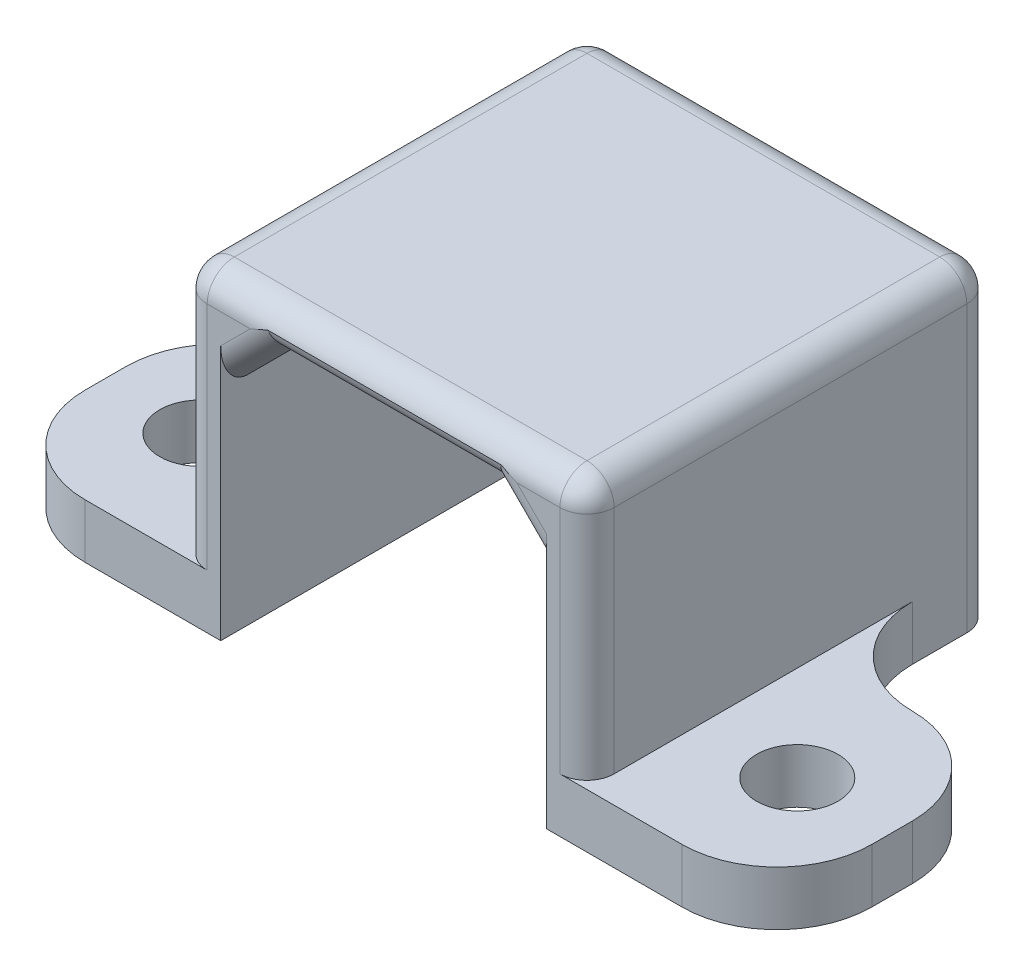
from build123d import *

# Parameters (mm, degrees)
SKETCH2_W           = 15
SKETCH2_H           = 11.5
BOSS_EXTRUDE1_DEPTH = 15
SKETCH3_W           = 12
SKETCH3_H           = 10
CUT_EXTRUDE1_DEPTH  = 15
SKETCH4_W           = 8.5
SKETCH4_H           = 2
BOSS_EXTRUDE2_DEPTH = 7
SKETCH5_R           = 1.5
CUT_EXTRUDE2_DEPTH  = 7
BOSS_EXTRUDE3_DEPTH = 15
SKETCH7_W           = 12
SKETCH7_H           = 0.7
CUT_EXTRUDE3_DEPTH  = 3
FILLET2_R           = 3.5
FILLET3_R           = 1


# Some blends are built 0.0001 mm under size
with BuildPart() as part:
    # Sketch2 → Boss-Extrude1 (new body)
    with BuildSketch(Plane.XY):
        Rectangle(SKETCH2_W, SKETCH2_H)
    extrude(amount=BOSS_EXTRUDE1_DEPTH)

    # Sketch3 → Cut-Extrude1 (cut)
    with BuildSketch(Plane.XY.offset(15)):
        with Locations((0, -0.75)):
            Rectangle(SKETCH3_W, SKETCH3_H)
    extrude(amount=-CUT_EXTRUDE1_DEPTH, mode=Mode.SUBTRACT)

    # Sketch4 → Boss-Extrude2 (add)
    with BuildSketch(Plane.ZY.offset(7.5)):
        with Locations((10.75, -4.75)):
            Rectangle(SKETCH4_W, SKETCH4_H)
    boss_extrude2 = extrude(amount=BOSS_EXTRUDE2_DEPTH)

    # Sketch5 → Cut-Extrude2 (cut)
    with BuildSketch(Plane(origin=(0, -3.75, 0), x_dir=(1, 0, 0), z_dir=(0, 1, 0))):
        with Locations(Location((-11, -10.75, 0), (0, 0, 270))):
            Circle(SKETCH5_R)
    cut_extrude2 = extrude(amount=-CUT_EXTRUDE2_DEPTH, mode=Mode.SUBTRACT)

    # Mirror3: Boss-Extrude2, Cut-Extrude2 across plane
    add(boss_extrude2.mirror(Plane(origin=(0, 0, 0), x_dir=(0, 0, 1), z_dir=(1, 0, 0))))
    add(cut_extrude2.mirror(Plane(origin=(0, 0, 0), x_dir=(0, 0, 1), z_dir=(1, 0, 0))), mode=Mode.SUBTRACT)

    # Sketch6 → Boss-Extrude3 (add)
    with BuildSketch(Plane.XY.offset(15)):
        Polygon((-6, 2.25), (-4, 4.25), (-6, 4.25), align=None)
        Polygon((4, 4.25), (6, 4.25), (6, 2.25), align=None)
    extrude(amount=-BOSS_EXTRUDE3_DEPTH)

    # Sketch7 → Cut-Extrude3 (cut)
    with BuildSketch(Plane.XZ.offset(-4.25)):
        with Locations((0, 4.65)):
            Rectangle(SKETCH7_W, SKETCH7_H)
        with Locations((0, 7.35)):
            Rectangle(SKETCH7_W, SKETCH7_H)
    extrude(amount=CUT_EXTRUDE3_DEPTH, mode=Mode.SUBTRACT)

    # Fillet2
    fillet2_edges = [part.edges().sort_by_distance(p)[0] for p in [
        (-7.5, -4.75, 6.5),
        (7.5, -4.75, 6.5),
        (14.5, -4.75, 15),
        (14.5, -4.75, 6.5),
        (-14.5, -4.75, 15),
        (-14.5, -4.75, 6.5),
    ]]
    fillet(fillet2_edges, radius=FILLET2_R - 0.0001)  # a hair under: the kernel refuses the full size

    # Fillet3
    # the kernel refuses this fillet: 1 mm, written as the material it takes off along each edge
    with BuildSketch(Plane(origin=(-6.5, 4.75, 14), x_dir=(0, 0, 1), z_dir=(-1, 0, 0))) as fillet3_piece_1_section:
        Polygon((0, 0), (FILLET3_R, 0), (FILLET3_R, FILLET3_R), (0, FILLET3_R), align=None)
    fillet3_piece_1 = extrude(amount=FILLET3_R, mode=Mode.PRIVATE)
    fillet3_piece_1 = fillet3_piece_1 - Plane(origin=(-6.5, 4.75, 14), x_dir=(0, -0.7071067811865475, -0.7071067811865475), z_dir=(-1, 0, 0)) * Sphere(FILLET3_R, mode=Mode.PRIVATE)
    add(fillet3_piece_1, mode=Mode.SUBTRACT)
    with BuildSketch(Plane(origin=(6.5, 4.75, 14), x_dir=(1, 0, 0), z_dir=(0, 0, 1))) as fillet3_piece_2_section:
        Polygon((0, 0), (FILLET3_R, 0), (FILLET3_R, FILLET3_R), (0, FILLET3_R), align=None)
    fillet3_piece_2 = extrude(amount=FILLET3_R, mode=Mode.PRIVATE)
    fillet3_piece_2 = fillet3_piece_2 - Plane(origin=(6.5, 4.75, 14), x_dir=(-0.7071067811865475, -0.7071067811865475, 0), z_dir=(0, 0, 1)) * Sphere(FILLET3_R, mode=Mode.PRIVATE)
    add(fillet3_piece_2, mode=Mode.SUBTRACT)
    with BuildSketch(Plane(origin=(-6.5, 4.75, 1), x_dir=(-1, 0, 0), z_dir=(0, 0, -1))) as fillet3_piece_3_section:
        Polygon((0, 0), (FILLET3_R, 0), (FILLET3_R, FILLET3_R), (0, FILLET3_R), align=None)
    fillet3_piece_3 = extrude(amount=FILLET3_R, mode=Mode.PRIVATE)
    fillet3_piece_3 = fillet3_piece_3 - Plane(origin=(-6.5, 4.75, 1), x_dir=(0.7071067811865475, -0.7071067811865475, 0), z_dir=(0, 0, -1)) * Sphere(FILLET3_R, mode=Mode.PRIVATE)
    add(fillet3_piece_3, mode=Mode.SUBTRACT)
    with BuildSketch(Plane(origin=(6.5, 4.75, 1), x_dir=(1, 0, 0), z_dir=(0, 0, -1))) as fillet3_piece_4_section:
        Polygon((0, 0), (FILLET3_R, 0), (FILLET3_R, -FILLET3_R), (0, -FILLET3_R), align=None)
    fillet3_piece_4 = extrude(amount=FILLET3_R, mode=Mode.PRIVATE)
    fillet3_piece_4 = fillet3_piece_4 - Plane(origin=(6.5, 4.75, 1), x_dir=(-0.7071067811865475, -0.7071067811865475, 0), z_dir=(0, 0, -1)) * Sphere(FILLET3_R, mode=Mode.PRIVATE)
    add(fillet3_piece_4, mode=Mode.SUBTRACT)
    with BuildSketch(Plane(origin=(-7.5, 4.75, 15), x_dir=(1, 0, 0), z_dir=(0, -1, 0)), Plane(origin=(7.5, -3.75, 15), x_dir=(-1, 0, 0), z_dir=(0, 1, 0))) as fillet3_piece_5:
        with BuildLine():
            CenterArc((FILLET3_R, -FILLET3_R), FILLET3_R, 90, 90)
            Line((0, -FILLET3_R), (0, 0))
            Line((0, 0), (FILLET3_R, 0))
        make_face()
    extrude(amount=8.5, mode=Mode.SUBTRACT)
    with BuildSketch(Plane(origin=(-7.5, 4.75, 0), x_dir=(1, 0, 0), z_dir=(0, -1, 0))) as fillet3_piece_6:
        with BuildLine():
            CenterArc((FILLET3_R, FILLET3_R), FILLET3_R, 180, 90)
            Line((0, FILLET3_R), (0, 0))
            Line((0, 0), (FILLET3_R, 0))
        make_face()
    extrude(amount=13, mode=Mode.SUBTRACT)
    with BuildSketch(Plane(origin=(6.5, 5.75, 0), x_dir=(0, 0, 1), z_dir=(-1, 0, 0)), Plane(origin=(7.5, -8.25, 0), x_dir=(0, 0, 1), z_dir=(0, 1, 0)), Plane(origin=(-7.5, 5.75, 1), x_dir=(1, 0, 0), z_dir=(0, 0, 1)), Plane(origin=(7.5, 5.75, 1), x_dir=(0, -1, 0), z_dir=(0, 0, 1)), Plane(origin=(6.5, 5.75, 15), x_dir=(0, -1, 0), z_dir=(-1, 0, 0))) as fillet3_piece_7:
        with BuildLine():
            CenterArc((FILLET3_R, -FILLET3_R), FILLET3_R, 90, 90)
            Line((0, -FILLET3_R), (0, 0))
            Line((0, 0), (FILLET3_R, 0))
        make_face()
    extrude(amount=13, mode=Mode.SUBTRACT)
    with BuildSketch(Plane(origin=(-7.767766953, 0.482233047, 15), x_dir=(-0.7071067811865476, 0.7071067811865477, 0), z_dir=(0.7071067811865476, 0.7071067811865475, 0))) as fillet3_piece_8_section:
        with BuildLine():
            CenterArc((FILLET3_R, -FILLET3_R), FILLET3_R, 90, 90)
            Line((0, -FILLET3_R), (0, 0))
            Line((0, 0), (FILLET3_R, 0))
        make_face()
    fillet3_piece_8 = extrude(amount=7.828427125, mode=Mode.PRIVATE)
    fillet3_piece_8 = split(fillet3_piece_8, bisect_by=Plane(origin=(-5.132418039, 4.25, 14.750489644), z_dir=(0, -1, 0)), keep=Keep.TOP, mode=Mode.PRIVATE)
    fillet3_piece_8 = split(fillet3_piece_8, bisect_by=Plane(origin=(-6, 3.382418039, 14.750489644), z_dir=(1, 0, 0)), keep=Keep.TOP, mode=Mode.PRIVATE)
    add(fillet3_piece_8, mode=Mode.SUBTRACT)
    with BuildSketch(Plane(origin=(-7.767766953, 0.482233047, 0), x_dir=(0, 0, 1), z_dir=(0.7071067811865476, 0.7071067811865475, 0))) as fillet3_piece_9_section:
        with BuildLine():
            CenterArc((FILLET3_R, -FILLET3_R), FILLET3_R, 90, 90)
            Line((0, -FILLET3_R), (0, 0))
            Line((0, 0), (FILLET3_R, 0))
        make_face()
    fillet3_piece_9 = extrude(amount=7.828427125, mode=Mode.PRIVATE)
    fillet3_piece_9 = split(fillet3_piece_9, bisect_by=Plane(origin=(-5.132418039, 4.25, 0.249510356), z_dir=(0, -1, 0)), keep=Keep.TOP, mode=Mode.PRIVATE)
    fillet3_piece_9 = split(fillet3_piece_9, bisect_by=Plane(origin=(-6, 3.382418039, 0.249510356), z_dir=(1, 0, 0)), keep=Keep.TOP, mode=Mode.PRIVATE)
    add(fillet3_piece_9, mode=Mode.SUBTRACT)
    with BuildSketch(Plane(origin=(6.5, 4.25, 15), x_dir=(0, 1, 0), z_dir=(-1, 0, 0))) as fillet3_piece_10_section:
        with BuildLine():
            CenterArc((FILLET3_R, FILLET3_R), FILLET3_R, 180, 90)
            Line((0, FILLET3_R), (0, 0))
            Line((0, 0), (FILLET3_R, 0))
        make_face()
    fillet3_piece_10 = extrude(amount=13, mode=Mode.PRIVATE)
    fillet3_piece_10 = split(fillet3_piece_10, bisect_by=Plane(origin=(1.892960565, 6.357039435, 14.766328896), z_dir=(-0.7071067811865475, -0.7071067811865476, 0)), keep=Keep.TOP, mode=Mode.PRIVATE)
    fillet3_piece_10 = split(fillet3_piece_10, bisect_by=Plane(origin=(-1.892960565, 6.357039435, 14.766328896), z_dir=(0.7071067811865475, -0.7071067811865476, 0)), keep=Keep.TOP, mode=Mode.PRIVATE)
    add(fillet3_piece_10, mode=Mode.SUBTRACT)
    with BuildSketch(Plane(origin=(6.5, 4.25, 0), x_dir=(0, 0, 1), z_dir=(-1, 0, 0))) as fillet3_piece_11_section:
        with BuildLine():
            CenterArc((FILLET3_R, FILLET3_R), FILLET3_R, 180, 90)
            Line((0, FILLET3_R), (0, 0))
            Line((0, 0), (FILLET3_R, 0))
        make_face()
    fillet3_piece_11 = extrude(amount=13, mode=Mode.PRIVATE)
    fillet3_piece_11 = split(fillet3_piece_11, bisect_by=Plane(origin=(1.892960565, 6.357039435, 0.233671104), z_dir=(-0.7071067811865475, -0.7071067811865476, 0)), keep=Keep.TOP, mode=Mode.PRIVATE)
    fillet3_piece_11 = split(fillet3_piece_11, bisect_by=Plane(origin=(-1.892960565, 6.357039435, 0.233671104), z_dir=(0.7071067811865475, -0.7071067811865476, 0)), keep=Keep.TOP, mode=Mode.PRIVATE)
    add(fillet3_piece_11, mode=Mode.SUBTRACT)
    with BuildSketch(Plane(origin=(7.767766953, 0.482233047, 15), x_dir=(0.7071067811865476, 0.7071067811865477, 0), z_dir=(-0.7071067811865476, 0.7071067811865475, 0))) as fillet3_piece_12_section:
        with BuildLine():
            CenterArc((FILLET3_R, FILLET3_R), FILLET3_R, 180, 90)
            Line((0, FILLET3_R), (0, 0))
            Line((0, 0), (FILLET3_R, 0))
        make_face()
    fillet3_piece_12 = extrude(amount=7.828427125, mode=Mode.PRIVATE)
    fillet3_piece_12 = split(fillet3_piece_12, bisect_by=Plane(origin=(6, 3.382418039, 14.750489644), z_dir=(-1, 0, 0)), keep=Keep.TOP, mode=Mode.PRIVATE)
    fillet3_piece_12 = split(fillet3_piece_12, bisect_by=Plane(origin=(5.132418039, 4.25, 14.750489644), z_dir=(0, -1, 0)), keep=Keep.TOP, mode=Mode.PRIVATE)
    add(fillet3_piece_12, mode=Mode.SUBTRACT)
    with BuildSketch(Plane(origin=(7.767766953, 0.482233047, 0), x_dir=(0, 0, 1), z_dir=(-0.7071067811865476, 0.7071067811865475, 0))) as fillet3_piece_13_section:
        with BuildLine():
            CenterArc((FILLET3_R, FILLET3_R), FILLET3_R, 180, 90)
            Line((0, FILLET3_R), (0, 0))
            Line((0, 0), (FILLET3_R, 0))
        make_face()
    fillet3_piece_13 = extrude(amount=7.828427125, mode=Mode.PRIVATE)
    fillet3_piece_13 = split(fillet3_piece_13, bisect_by=Plane(origin=(6, 3.382418039, 0.249510356), z_dir=(-1, 0, 0)), keep=Keep.TOP, mode=Mode.PRIVATE)
    fillet3_piece_13 = split(fillet3_piece_13, bisect_by=Plane(origin=(5.132418039, 4.25, 0.249510356), z_dir=(0, -1, 0)), keep=Keep.TOP, mode=Mode.PRIVATE)
    add(fillet3_piece_13, mode=Mode.SUBTRACT)
    with BuildSketch(Plane(origin=(-7.767766953, 0.482233047, 15), x_dir=(-0.7071067811865476, 0.7071067811865477, 0), z_dir=(0.7071067811865476, 0.7071067811865475, 0))) as fillet3_piece_14a_section:
        with BuildLine():
            CenterArc((FILLET3_R, -FILLET3_R), FILLET3_R, 90, 90)
            Line((0, -FILLET3_R), (0, 0))
            Line((0, 0), (FILLET3_R, 0))
        make_face()
    fillet3_piece_14a = extrude(amount=7.828427125, mode=Mode.PRIVATE)
    fillet3_piece_14a = split(fillet3_piece_14a, bisect_by=Plane(origin=(-3.374325792, 4.25, 14.783675587), z_dir=(0, 1, 0)), keep=Keep.TOP, mode=Mode.PRIVATE)
    with BuildSketch(Plane(origin=(6.5, 4.25, 15), x_dir=(0, 1, 0), z_dir=(-1, 0, 0))) as fillet3_piece_14b_section:
        with BuildLine():
            CenterArc((FILLET3_R, FILLET3_R), FILLET3_R, 180, 90)
            Line((0, FILLET3_R), (0, 0))
            Line((0, 0), (FILLET3_R, 0))
        make_face()
    fillet3_piece_14b = extrude(amount=13, mode=Mode.PRIVATE)
    fillet3_piece_14b = split(fillet3_piece_14b, bisect_by=Plane(origin=(-4.442418475, 3.807581525, 14.783675587), z_dir=(-0.7071067811865475, 0.7071067811865476, 0)), keep=Keep.TOP, mode=Mode.PRIVATE)
    fillet3_piece_14 = fillet3_piece_14a & fillet3_piece_14b
    add(fillet3_piece_14, mode=Mode.SUBTRACT)
    with BuildSketch(Plane(origin=(6.5, 4.25, 0), x_dir=(0, 0, 1), z_dir=(-1, 0, 0))) as fillet3_piece_15a_section:
        with BuildLine():
            CenterArc((FILLET3_R, FILLET3_R), FILLET3_R, 180, 90)
            Line((0, FILLET3_R), (0, 0))
            Line((0, 0), (FILLET3_R, 0))
        make_face()
    fillet3_piece_15a = extrude(amount=13, mode=Mode.PRIVATE)
    fillet3_piece_15a = split(fillet3_piece_15a, bisect_by=Plane(origin=(-4.442418475, 3.807581525, 0.216324413), z_dir=(-0.7071067811865475, 0.7071067811865476, 0)), keep=Keep.TOP, mode=Mode.PRIVATE)
    with BuildSketch(Plane(origin=(-7.767766953, 0.482233047, 0), x_dir=(0, 0, 1), z_dir=(0.7071067811865476, 0.7071067811865475, 0))) as fillet3_piece_15b_section:
        with BuildLine():
            CenterArc((FILLET3_R, -FILLET3_R), FILLET3_R, 90, 90)
            Line((0, -FILLET3_R), (0, 0))
            Line((0, 0), (FILLET3_R, 0))
        make_face()
    fillet3_piece_15b = extrude(amount=7.828427125, mode=Mode.PRIVATE)
    fillet3_piece_15b = split(fillet3_piece_15b, bisect_by=Plane(origin=(-3.374325792, 4.25, 0.216324413), z_dir=(0, 1, 0)), keep=Keep.TOP, mode=Mode.PRIVATE)
    fillet3_piece_15 = fillet3_piece_15a & fillet3_piece_15b
    add(fillet3_piece_15, mode=Mode.SUBTRACT)
    with BuildSketch(Plane(origin=(6.5, 4.25, 15), x_dir=(0, 1, 0), z_dir=(-1, 0, 0))) as fillet3_piece_16a_section:
        with BuildLine():
            CenterArc((FILLET3_R, FILLET3_R), FILLET3_R, 180, 90)
            Line((0, FILLET3_R), (0, 0))
            Line((0, 0), (FILLET3_R, 0))
        make_face()
    fillet3_piece_16a = extrude(amount=13, mode=Mode.PRIVATE)
    fillet3_piece_16a = split(fillet3_piece_16a, bisect_by=Plane(origin=(4.442418475, 3.807581525, 14.783675587), z_dir=(0.7071067811865475, 0.7071067811865476, 0)), keep=Keep.TOP, mode=Mode.PRIVATE)
    with BuildSketch(Plane(origin=(7.767766953, 0.482233047, 15), x_dir=(0.7071067811865476, 0.7071067811865477, 0), z_dir=(-0.7071067811865476, 0.7071067811865475, 0))) as fillet3_piece_16b_section:
        with BuildLine():
            CenterArc((FILLET3_R, FILLET3_R), FILLET3_R, 180, 90)
            Line((0, FILLET3_R), (0, 0))
            Line((0, 0), (FILLET3_R, 0))
        make_face()
    fillet3_piece_16b = extrude(amount=7.828427125, mode=Mode.PRIVATE)
    fillet3_piece_16b = split(fillet3_piece_16b, bisect_by=Plane(origin=(3.374325792, 4.25, 14.783675587), z_dir=(0, 1, 0)), keep=Keep.TOP, mode=Mode.PRIVATE)
    fillet3_piece_16 = fillet3_piece_16a & fillet3_piece_16b
    add(fillet3_piece_16, mode=Mode.SUBTRACT)
    with BuildSketch(Plane(origin=(7.767766953, 0.482233047, 0), x_dir=(0, 0, 1), z_dir=(-0.7071067811865476, 0.7071067811865475, 0))) as fillet3_piece_17a_section:
        with BuildLine():
            CenterArc((FILLET3_R, FILLET3_R), FILLET3_R, 180, 90)
            Line((0, FILLET3_R), (0, 0))
            Line((0, 0), (FILLET3_R, 0))
        make_face()
    fillet3_piece_17a = extrude(amount=7.828427125, mode=Mode.PRIVATE)
    fillet3_piece_17a = split(fillet3_piece_17a, bisect_by=Plane(origin=(3.374325792, 4.25, 0.216324413), z_dir=(0, 1, 0)), keep=Keep.TOP, mode=Mode.PRIVATE)
    with BuildSketch(Plane(origin=(6.5, 4.25, 0), x_dir=(0, 0, 1), z_dir=(-1, 0, 0))) as fillet3_piece_17b_section:
        with BuildLine():
            CenterArc((FILLET3_R, FILLET3_R), FILLET3_R, 180, 90)
            Line((0, FILLET3_R), (0, 0))
            Line((0, 0), (FILLET3_R, 0))
        make_face()
    fillet3_piece_17b = extrude(amount=13, mode=Mode.PRIVATE)
    fillet3_piece_17b = split(fillet3_piece_17b, bisect_by=Plane(origin=(4.442418475, 3.807581525, 0.216324413), z_dir=(0.7071067811865475, 0.7071067811865476, 0)), keep=Keep.TOP, mode=Mode.PRIVATE)
    fillet3_piece_17 = fillet3_piece_17a & fillet3_piece_17b
    add(fillet3_piece_17, mode=Mode.SUBTRACT)


solid = part.part
